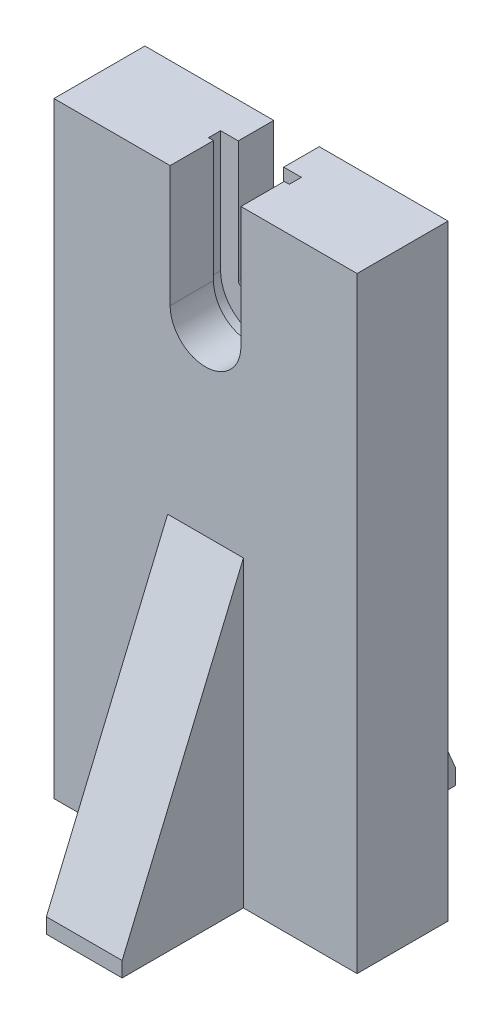
from build123d import *

# Parameters (mm, degrees)
SKETCH1_W           = 20
SKETCH1_H           = 40
BOSS_EXTRUDE1_DEPTH = 6
CUT_EXTRUDE1_DEPTH  = 8
CUT_EXTRUDE2_DEPTH  = 2.86
CUT_EXTRUDE3_DEPTH  = 0.8
CUT_EXTRUDE4_DEPTH  = 45.870876969
SKETCH8_W           = 5
SKETCH8_H           = 8
BOSS_EXTRUDE2_DEPTH = 1
RIB2_REACH          = 44
SKETCH9_WALL_W      = 106.615528128
SKETCH9_WALL_H      = 5
SHELL1_START        = 1
SHELL1_DEPTH        = 4
SHELL1_2_DEPTH      = 0.34
SHELL1_START_2      = 4.14
SHELL1_3_DEPTH      = 0.86
SHELL1_START_3      = 8.5
SHELL1_4_DEPTH      = 3


with BuildPart() as part:
    # Sketch1 → Boss-Extrude1 (new body)
    with BuildSketch(Plane.XY):
        with Locations((10, 20)):
            Rectangle(SKETCH1_W, SKETCH1_H)
    extrude(amount=BOSS_EXTRUDE1_DEPTH)

    # Sketch2 → Cut-Extrude1 (cut)
    with BuildSketch(Plane(origin=(0, 40, 0), x_dir=(1, 0, 0), z_dir=(0, 1, 0))):
        Polygon((12.665, -2.34), (12.665, -3.14), (12.335, -3.14), (12.335, -6), (7.665, -6), (7.665, -3.14), (7.335, -3.14), (7.335, -2.34), (8.5, -2.34), (8.5, 0), (11.5, 0), (11.5, -2.34), align=None)
    extrude(amount=-CUT_EXTRUDE1_DEPTH, mode=Mode.SUBTRACT)

    # Sketch3 → Cut-Extrude2 (cut)
    with BuildSketch(Plane.XY.offset(6)):
        with BuildLine():
            Line((7.665, 32), (12.335, 32))
            ThreePointArc((12.335, 32), (10, 29.665), (7.665, 32))
        make_face()
    extrude(amount=-CUT_EXTRUDE2_DEPTH, mode=Mode.SUBTRACT)

    # Sketch5 → Cut-Extrude3 (cut)
    with BuildSketch(Plane.XY.offset(3.14)):
        with BuildLine():
            Line((7.335, 32), (12.665, 32))
            ThreePointArc((12.665, 32), (10, 29.335), (7.335, 32))
        make_face()
    extrude(amount=-CUT_EXTRUDE3_DEPTH, mode=Mode.SUBTRACT)

    # Sketch7 → Cut-Extrude4 (cut, through all)
    with BuildSketch(Plane.XY.offset(2.34)):
        with BuildLine():
            Line((9.77, 30.73), (9.77, 32))
            Line((9.77, 32), (10.23, 32))
            Line((10.23, 32), (10.23, 30.73))
            ThreePointArc((10.23, 30.73), (10, 30.5), (9.77, 30.73))
        make_face()
        with BuildLine():
            Line((8.5, 32), (8.96, 32))
            ThreePointArc((8.96, 32), (8.73, 31.77), (8.5, 32))
        make_face()
        with BuildLine():
            Line((11.04, 32), (11.5, 32))
            ThreePointArc((11.5, 32), (11.27, 31.77), (11.04, 32))
        make_face()
    extrude(amount=-CUT_EXTRUDE4_DEPTH, mode=Mode.SUBTRACT)

    # Sketch8 → Boss-Extrude2 (add)
    with BuildSketch(Plane.XZ):
        with Locations((10, -4)):
            Rectangle(SKETCH8_W, SKETCH8_H)
    boss_extrude2 = extrude(amount=-BOSS_EXTRUDE2_DEPTH)

    # Sketch9 wall → Rib2 (add, up to next)
    with BuildSketch(Plane(origin=(10, 10.5, -4), x_dir=(0, 0.921635375138, 0.388057000058), z_dir=(0, -0.388057000058, 0.921635375138)), mode=Mode.PRIVATE) as rib2_sk1:
        Rectangle(SKETCH9_WALL_W, SKETCH9_WALL_H)
    rib2_tool1 = extrude(rib2_sk1.sketch, amount=RIB2_REACH, mode=Mode.PRIVATE) - part.part
    rib2 = rib2_tool1.solids().sort_by_distance((10, 10.5, -4))[0]
    add(rib2)

    # Mirror1: Boss-Extrude2, Rib2 across plane
    add(boss_extrude2.mirror(Plane.XY.offset(3)))
    add(rib2.mirror(Plane.XY.offset(3)))

    # Shell1: read off the stored shape, not the designer's step
    # Shell1 outline → Shell1 (cut)
    with BuildSketch(Plane.XY.offset(SHELL1_START)):
        with BuildLine():
            Line((6.335, 32), (6.335, 39))
            Line((6.335, 39), (1, 39))
            Line((1, 39), (1, 0))
            Line((1, 0), (8.5, 0))
            Line((8.5, 0), (11.5, 0))
            Line((11.5, 0), (19, 0))
            Line((19, 0), (19, 39))
            Line((19, 39), (13.665, 39))
            Line((13.665, 39), (13.665, 32))
            ThreePointArc((13.665, 32), (10, 28.335), (6.335, 32))
        make_face()
    extrude(amount=SHELL1_DEPTH, mode=Mode.SUBTRACT)

    # Shell1 2 outline → Shell1 2 (cut)
    with BuildSketch(Plane.XY.offset(SHELL1_START)):
        with BuildLine():
            Line((7.5, 32), (7.5, 39))
            Line((7.5, 39), (6.335, 39))
            Line((6.335, 39), (6.335, 32))
            ThreePointArc((6.335, 32), (10, 28.335), (13.665, 32))
            Line((13.665, 32), (13.665, 39))
            Line((13.665, 39), (12.5, 39))
            Line((12.5, 39), (12.5, 32))
            ThreePointArc((12.5, 32), (12.12548232, 31.116229668), (11.23, 30.770650579))
            Line((11.23, 30.770650579), (11.23, 30.73))
            ThreePointArc((11.23, 30.73), (10, 29.5), (8.77, 30.73))
            Line((8.77, 30.73), (8.77, 30.770650579))
            ThreePointArc((8.77, 30.770650579), (7.87451768, 31.116229668), (7.5, 32))
        make_face()
    extrude(amount=SHELL1_2_DEPTH, mode=Mode.SUBTRACT)

    # Shell1 3 outline → Shell1 3 (cut)
    with BuildSketch(Plane.XY.offset(SHELL1_START_2)):
        with BuildLine():
            Line((6.665, 32), (6.665, 39))
            Line((6.665, 39), (6.335, 39))
            Line((6.335, 39), (6.335, 32))
            ThreePointArc((6.335, 32), (10, 28.335), (13.665, 32))
            Line((13.665, 32), (13.665, 39))
            Line((13.665, 39), (13.335, 39))
            Line((13.335, 39), (13.335, 32))
            ThreePointArc((13.335, 32), (10, 28.665), (6.665, 32))
        make_face()
    extrude(amount=SHELL1_3_DEPTH, mode=Mode.SUBTRACT)

    # Shell1 4 outline → Shell1 4 (cut)
    with BuildSketch(Plane.YZ.offset(SHELL1_START_3)):
        Polygon((0, 1), (0, -7), (0.798058984, -7), (19.798058984, 1), align=None)
        Polygon((0, 13), (0, 5), (19.798058984, 5), (0.798058984, 13), align=None)
    extrude(amount=SHELL1_4_DEPTH, mode=Mode.SUBTRACT)


solid = part.part
